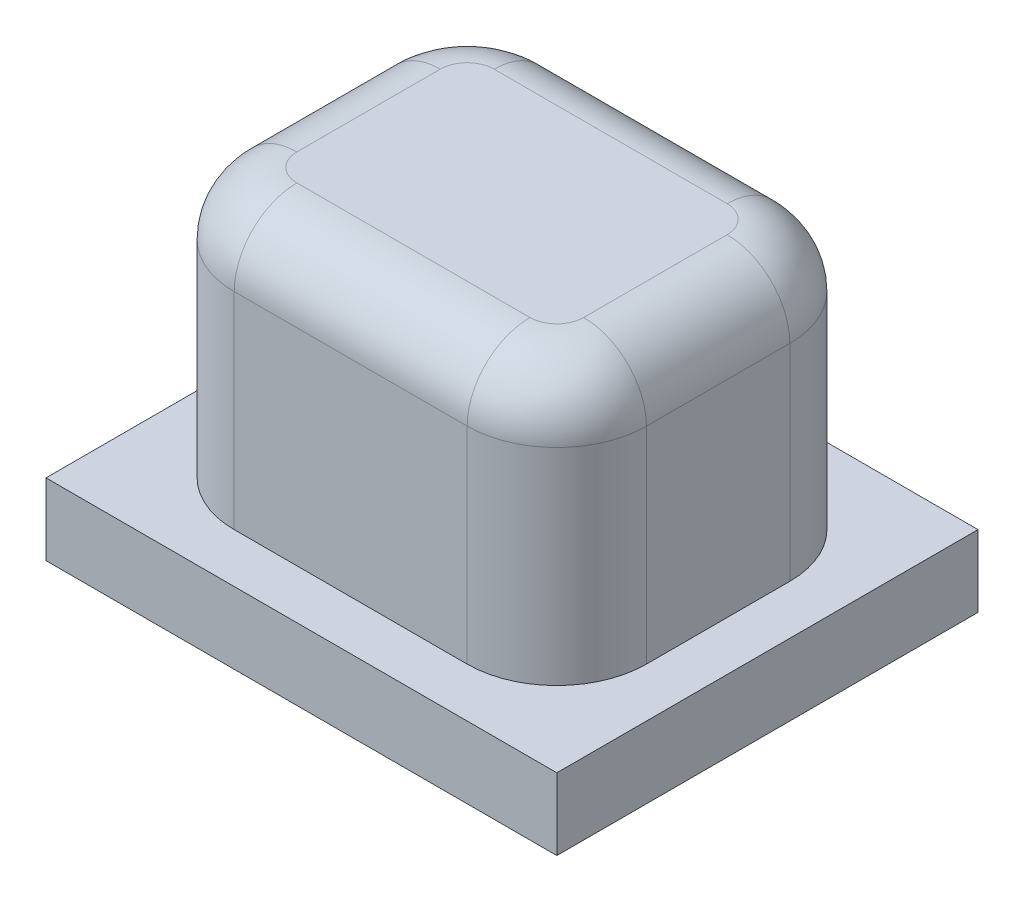
from build123d import *

# Parameters (mm, degrees)
EXTRUDE_332_DEPTH     = 3
SKETCH_2_W            = 5.7
SKETCH_2_H            = 4.7
EXTRUDE_566_DEPTH     = 0.8
CUT_EXTRUDE_806_DEPTH = 2.8
FILLET_1_R            = 0.7


with BuildPart() as part:
    # 草图1 → Extrude 332 (new body)
    with BuildSketch(Plane(origin=(0, 0, 0), x_dir=(1, 0, 0), z_dir=(0, 1, 0))):
        with BuildLine():
            Line((-1.3, -1.8), (1.3, -1.8))
            ThreePointArc((1.3, -1.8), (2.007106781, -1.507106781), (2.3, -0.8))
            Line((2.3, -0.8), (2.3, 0.8))
            ThreePointArc((2.3, 0.8), (2.007106781, 1.507106781), (1.3, 1.8))
            Line((1.3, 1.8), (-1.3, 1.8))
            ThreePointArc((-1.3, 1.8), (-2.007106781, 1.507106781), (-2.3, 0.8))
            Line((-2.3, 0.8), (-2.3, -0.8))
            ThreePointArc((-2.3, -0.8), (-2.007106781, -1.507106781), (-1.3, -1.8))
        make_face()
    extrude(amount=EXTRUDE_332_DEPTH)

    # 草图2 → Extrude 566 (add)
    with BuildSketch(Plane.XZ):
        Rectangle(SKETCH_2_W, SKETCH_2_H)
    extrude(amount=EXTRUDE_566_DEPTH)

    # 草图3 → Cut-Extrude 806 (cut)
    with BuildSketch(Plane.XZ.offset(0.8)):
        with BuildLine():
            Line((-0.75, -1.25), (0.75, -1.25))
            ThreePointArc((0.75, -1.25), (1.457106781, -0.957106781), (1.75, -0.25))
            Line((1.75, -0.25), (1.75, 0.25))
            ThreePointArc((1.75, 0.25), (1.457106781, 0.957106781), (0.75, 1.25))
            Line((0.75, 1.25), (-0.75, 1.25))
            ThreePointArc((-0.75, 1.25), (-1.457106781, 0.957106781), (-1.75, 0.25))
            Line((-1.75, 0.25), (-1.75, -0.25))
            ThreePointArc((-1.75, -0.25), (-1.457106781, -0.957106781), (-0.75, -1.25))
        make_face()
    extrude(amount=-CUT_EXTRUDE_806_DEPTH, mode=Mode.SUBTRACT)

    # 圆角1
    fillet_1_edges = [part.edges().sort_by_distance(p)[0] for p in [
        (2.007106781, 3, -1.507106781),
        (2.3, 3, 0),
        (2.007106781, 3, 1.507106781),
        (0, 3, 1.8),
        (-2.007106781, 3, 1.507106781),
        (-2.3, 3, 0),
        (-2.007106781, 3, -1.507106781),
        (0, 3, -1.8),
    ]]
    fillet(fillet_1_edges, radius=FILLET_1_R)


solid = part.part
